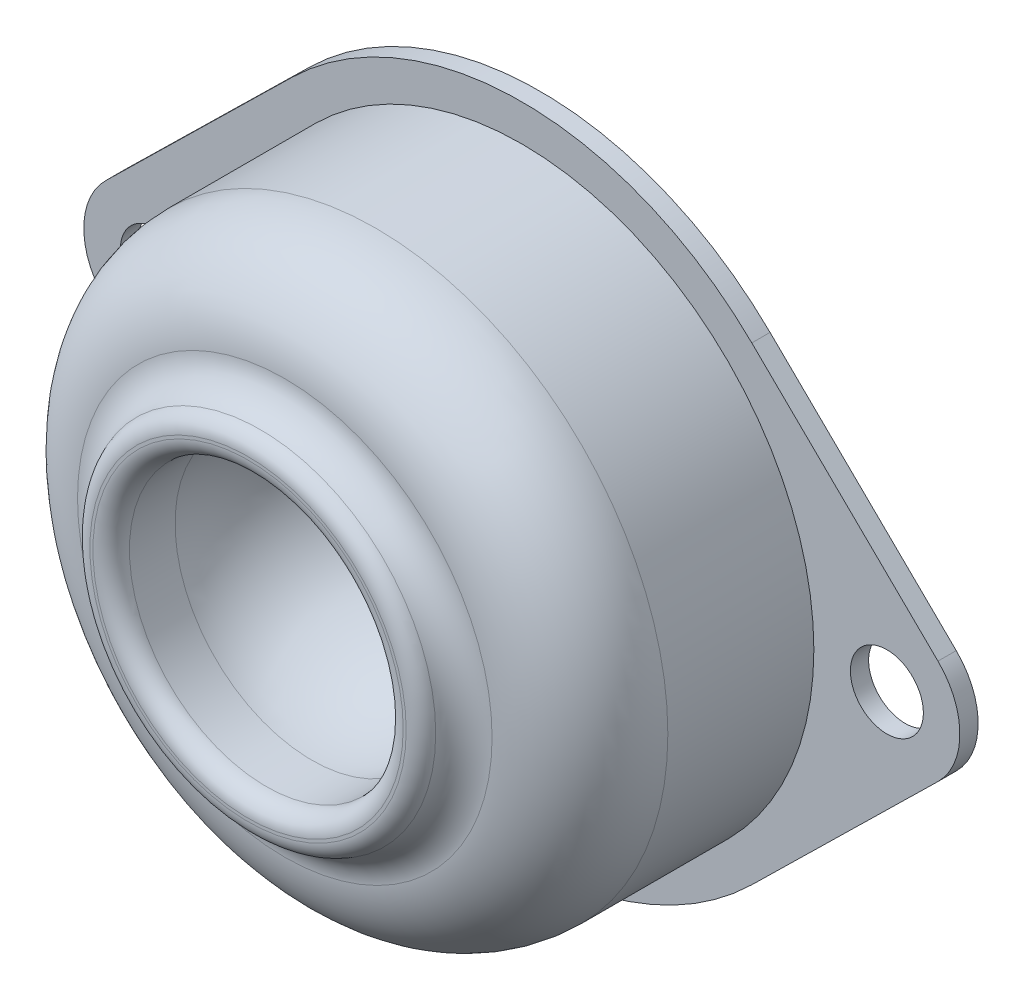
from build123d import *

# Parameters (mm, degrees)
SKETCH1_R           = 2
BOSS_EXTRUDE1_DEPTH = 1
SKETCH2_R           = 16
BOSS_EXTRUDE2_DEPTH = 13
SKETCH3_R           = 9.5
BOSS_EXTRUDE3_DEPTH = 2
FILLET1_R           = 5
FILLET2_R           = 2
SKETCH4_R           = 7.5
CUT_EXTRUDE1_DEPTH  = 11
FILLET3_R           = 7.5
FILLET4_R           = 1
FILLET5_R           = 1


with BuildPart() as part:
    # Sketch1 → Boss-Extrude1 (new body)
    with BuildSketch(Plane.XY):
        with BuildLine():
            Line((-12.6, 12.854571171), (-22.8, 2.856571371))
            ThreePointArc((-22.8, 2.856571371), (-24, 0), (-22.8, -2.856571371))
            Line((-22.8, -2.856571371), (-12.6, -12.854571171))
            ThreePointArc((-12.6, -12.854571171), (0, -18), (12.6, -12.854571171))
            Line((12.6, -12.854571171), (22.8, -2.856571371))
            ThreePointArc((22.8, -2.856571371), (24, 0), (22.8, 2.856571371))
            Line((22.8, 2.856571371), (12.6, 12.854571171))
            ThreePointArc((12.6, 12.854571171), (0, 18), (-12.6, 12.854571171))
        make_face()
        with Locations((-20, 0)):
            Circle(SKETCH1_R, mode=Mode.SUBTRACT)
        with Locations((20, 0)):
            Circle(SKETCH1_R, mode=Mode.SUBTRACT)
    extrude(amount=BOSS_EXTRUDE1_DEPTH)

    # Sketch2 → Boss-Extrude2 (add)
    with BuildSketch(Plane.XY.offset(1)):
        with Locations(Location((0, 0, 0), (0, 0, 180))):
            Circle(SKETCH2_R)
    extrude(amount=BOSS_EXTRUDE2_DEPTH)

    # Sketch3 → Boss-Extrude3 (add)
    with BuildSketch(Plane.XY.offset(14)):
        Circle(SKETCH3_R)
    extrude(amount=BOSS_EXTRUDE3_DEPTH)

    # Fillet1
    fillet1_edges = [part.edges().sort_by_distance(p)[0] for p in [
        (16, 0, 14),
    ]]
    fillet(fillet1_edges, radius=FILLET1_R)

    # Fillet2
    fillet2_edges = [part.edges().sort_by_distance(p)[0] for p in [
        (-9.5, 0, 14),
    ]]
    fillet(fillet2_edges, radius=FILLET2_R - 0.0001)  # a hair under: the kernel refuses the full size

    # Sketch4 → Cut-Extrude1 (cut)
    with BuildSketch(Plane.XY.offset(16)):
        Circle(SKETCH4_R)
    extrude(amount=-CUT_EXTRUDE1_DEPTH, mode=Mode.SUBTRACT)

    # Fillet3
    fillet3_edges = [part.edges().sort_by_distance(p)[0] for p in [
        (-7.5, 0, 5),
    ]]
    fillet(fillet3_edges, radius=FILLET3_R)

    # Fillet4
    fillet4_edges = [part.edges().sort_by_distance(p)[0] for p in [
        (-9.5, 0, 16),
    ]]
    fillet(fillet4_edges, radius=FILLET4_R)

    # Fillet5
    fillet5_edges = [part.edges().sort_by_distance(p)[0] for p in [
        (-7.5, 0, 16),
    ]]
    fillet(fillet5_edges, radius=FILLET5_R)


solid = part.part
